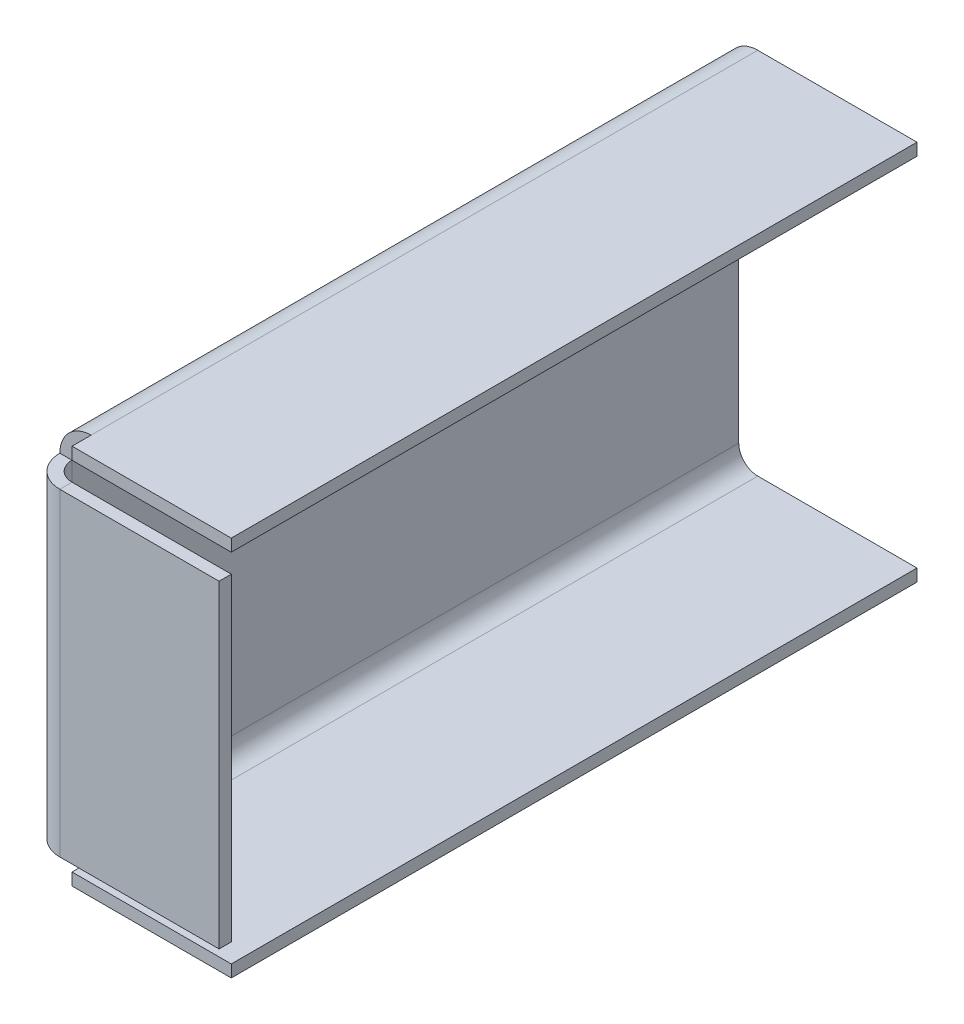
from build123d import *

# Parameters (mm, degrees)
SKETCH1_W                      = 114.3
SKETCH1_H                      = 63.5
BASE_FLANGE1_DEPTH             = 2.032
EDGE_FLANGE1_STRIP_W           = 14.478
EDGE_FLANGE1_STRIP_H           = 2.032
EDGE_FLANGE1_STRIP_CUT_DEPTH   = 114.3
EDGE_FLANGE1_STRIP_2_W         = 14.478
EDGE_FLANGE1_STRIP_2_H         = 2.032
EDGE_FLANGE1_STRIP_CUT_2_DEPTH = 114.3
EDGE_FLANGE1_DEPTH             = 114.3
EDGE_FLANGE1_BEND_DEPTH        = 114.3
EDGE_FLANGE2_DEPTH             = 63.5
EDGE_FLANGE2_2_DEPTH           = 5.207
EDGE_FLANGE2_START             = 58.293
EDGE_FLANGE2_3_DEPTH           = 5.207
EDGE_FLANGE2_START_2           = 5.207
EDGE_FLANGE2_4_DEPTH           = 53.086


# Read off the part's stored shape, not the designer's step: Edge-Flange2
# Sheet-metal steps are written as plain solids
with BuildPart() as part:
    # Sketch1 → Base-Flange1 (new body)
    with BuildSketch(Plane(origin=(0, 0, 0), x_dir=(0, 0, -1), z_dir=(1, 0, 0))):
        with Locations((57.15, 31.75)):
            Rectangle(SKETCH1_W, SKETCH1_H)
    extrude(amount=-BASE_FLANGE1_DEPTH)

    # Edge-Flange1 strip (across the edge) → Edge-Flange1 strip cut (cut)
    with BuildSketch(Plane(origin=(0, 63.5, -114.3), x_dir=(0, -1, 0), z_dir=(0, 0, 1))):
        with Locations((-2.032, -1.016)):
            Rectangle(EDGE_FLANGE1_STRIP_W, EDGE_FLANGE1_STRIP_H)
    extrude(amount=EDGE_FLANGE1_STRIP_CUT_DEPTH, mode=Mode.SUBTRACT)

    # Edge-Flange1 strip 2 (across the edge) → Edge-Flange1 strip cut 2 (cut)
    with BuildSketch(Plane.YX):
        with Locations((-2.032, -1.016)):
            Rectangle(EDGE_FLANGE1_STRIP_2_W, EDGE_FLANGE1_STRIP_2_H)
    extrude(amount=EDGE_FLANGE1_STRIP_CUT_2_DEPTH, mode=Mode.SUBTRACT)

    # Edge-Flange1 section (across the edge) → Edge-Flange1 (add)
    with BuildSketch(Plane(origin=(0, 63.5, -114.3), x_dir=(0, -1, 0), z_dir=(0, 0, 1))):
        with BuildLine():
            Line((0, 3.175), (0, 29.718))
            Line((0, 29.718), (2.032, 29.718))
            Line((2.032, 29.718), (2.032, 3.175))
            ThreePointArc((2.032, 3.175), (2.96193597, 0.92993597), (5.207, 0))
            Line((5.207, 0), (5.207, -2.032))
            ThreePointArc((5.207, -2.032), (1.52509499, -0.50690501), (0, 3.175))
        make_face()
    extrude(amount=EDGE_FLANGE1_DEPTH)

    # Edge-Flange1 section 2 (across the edge) → Edge-Flange1 bend (add)
    with BuildSketch(Plane.YX):
        with BuildLine():
            Line((0, 3.175), (0, 29.718))
            Line((0, 29.718), (2.032, 29.718))
            Line((2.032, 29.718), (2.032, 3.175))
            ThreePointArc((2.032, 3.175), (2.96193597, 0.92993597), (5.207, 0))
            Line((5.207, 0), (5.207, -2.032))
            ThreePointArc((5.207, -2.032), (1.52509499, -0.50690501), (0, 3.175))
        make_face()
    extrude(amount=EDGE_FLANGE1_BEND_DEPTH)

    # Edge-Flange2 outline → Edge-Flange2 (cut)
    with BuildSketch(Plane(origin=(0, 0, 0), x_dir=(1, 0, 0), z_dir=(0, 1, 0))):
        with BuildLine():
            Line((3.175, 0), (3.175, 3.175))
            Line((3.175, 3.175), (0, 3.175))
            ThreePointArc((0, 3.175), (0.92993597, 0.92993597), (3.175, 0))
        make_face()
        with BuildLine():
            ThreePointArc((-0.95201151, 0), (-1.754614485, 1.498172628), (-2.032, 3.175))
            Line((-2.032, 3.175), (-2.032, 0))
            Line((-2.032, 0), (-0.95201151, 0))
        make_face()
    extrude(amount=EDGE_FLANGE2_DEPTH, mode=Mode.SUBTRACT)

    # Edge-Flange2 2 outline → Edge-Flange2 2 (cut)
    with BuildSketch(Plane(origin=(0, 0, 0), x_dir=(1, 0, 0), z_dir=(0, 1, 0))):
        with BuildLine():
            ThreePointArc((3.175, 0), (0.92993597, 0.92993597), (0, 3.175))
            Line((0, 3.175), (-2.032, 3.175))
            ThreePointArc((-2.032, 3.175), (-1.754614485, 1.498172628), (-0.95201151, 0))
            Line((-0.95201151, 0), (3.175, 0))
        make_face()
    extrude(amount=EDGE_FLANGE2_2_DEPTH, mode=Mode.SUBTRACT)

    # Edge-Flange2 3 outline → Edge-Flange2 3 (cut)
    with BuildSketch(Plane(origin=(0, 0, 0), x_dir=(1, 0, 0), z_dir=(0, 1, 0)).offset(EDGE_FLANGE2_START)):
        with BuildLine():
            ThreePointArc((3.175, 0), (0.92993597, 0.92993597), (0, 3.175))
            Line((0, 3.175), (-2.032, 3.175))
            ThreePointArc((-2.032, 3.175), (-1.754614485, 1.498172628), (-0.95201151, 0))
            Line((-0.95201151, 0), (3.175, 0))
        make_face()
    extrude(amount=EDGE_FLANGE2_3_DEPTH, mode=Mode.SUBTRACT)

    # Edge-Flange2 4 outline → Edge-Flange2 4 (add)
    with BuildSketch(Plane(origin=(0, 0, 0), x_dir=(1, 0, 0), z_dir=(0, 1, 0)).offset(EDGE_FLANGE2_START_2)):
        with BuildLine():
            Line((0, 3.175), (0, 0))
            Line((0, 0), (-0.95201151, 0))
            ThreePointArc((-0.95201151, 0), (0.874932175, -1.496459836), (3.175, -2.032))
            Line((3.175, -2.032), (29.718, -2.032))
            Line((29.718, -2.032), (29.718, 0))
            Line((29.718, 0), (3.175, 0))
            ThreePointArc((3.175, 0), (0.92993597, 0.92993597), (0, 3.175))
        make_face()
    extrude(amount=EDGE_FLANGE2_4_DEPTH)


solid = part.part
